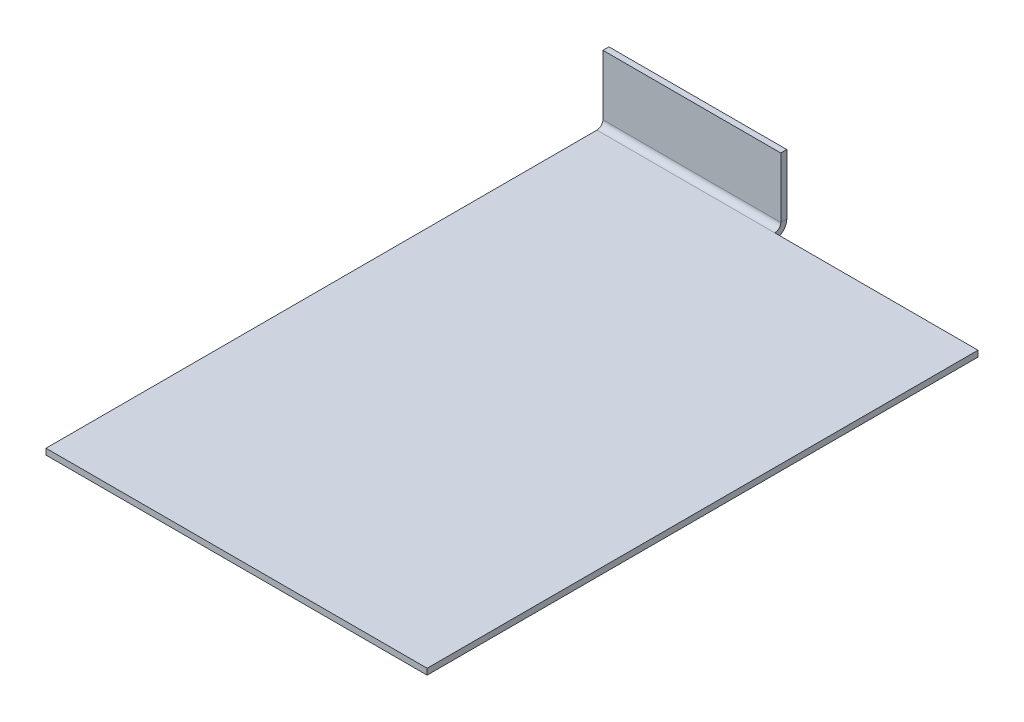
from build123d import *

# Parameters (mm, degrees)
SKETCH1_W          = 201.20864
SKETCH1_H          = 290.83
BASE_FLANGE1_DEPTH = 3.175
EDGE_FLANGE1_DEPTH = 93.921520056


# Sheet-metal steps are written as plain solids
with BuildPart() as part:
    # Sketch1 → Base-Flange1 (new body)
    with BuildSketch(Plane(origin=(0, 0, 0), x_dir=(1, 0, 0), z_dir=(0, 1, 0))):
        with Locations((100.60432, 145.415)):
            Rectangle(SKETCH1_W, SKETCH1_H)
    extrude(amount=-BASE_FLANGE1_DEPTH)

    # Edge-Flange1 section (across the edge) → Edge-Flange1 (add)
    with BuildSketch(Plane(origin=(93.921520056, 0, -294.005), x_dir=(0, 0, 1), z_dir=(-1, 0, 0))):
        with BuildLine():
            Line((-3.175, 3.175), (-3.175, 34.925))
            Line((-3.175, 34.925), (0, 34.925))
            Line((0, 34.925), (0, 3.175))
            ThreePointArc((0, 3.175), (0.92993597, 0.92993597), (3.175, 0))
            Line((3.175, 0), (3.175, -3.175))
            ThreePointArc((3.175, -3.175), (-1.315128061, -1.315128061), (-3.175, 3.175))
        make_face()
    extrude(amount=EDGE_FLANGE1_DEPTH)


solid = part.part
